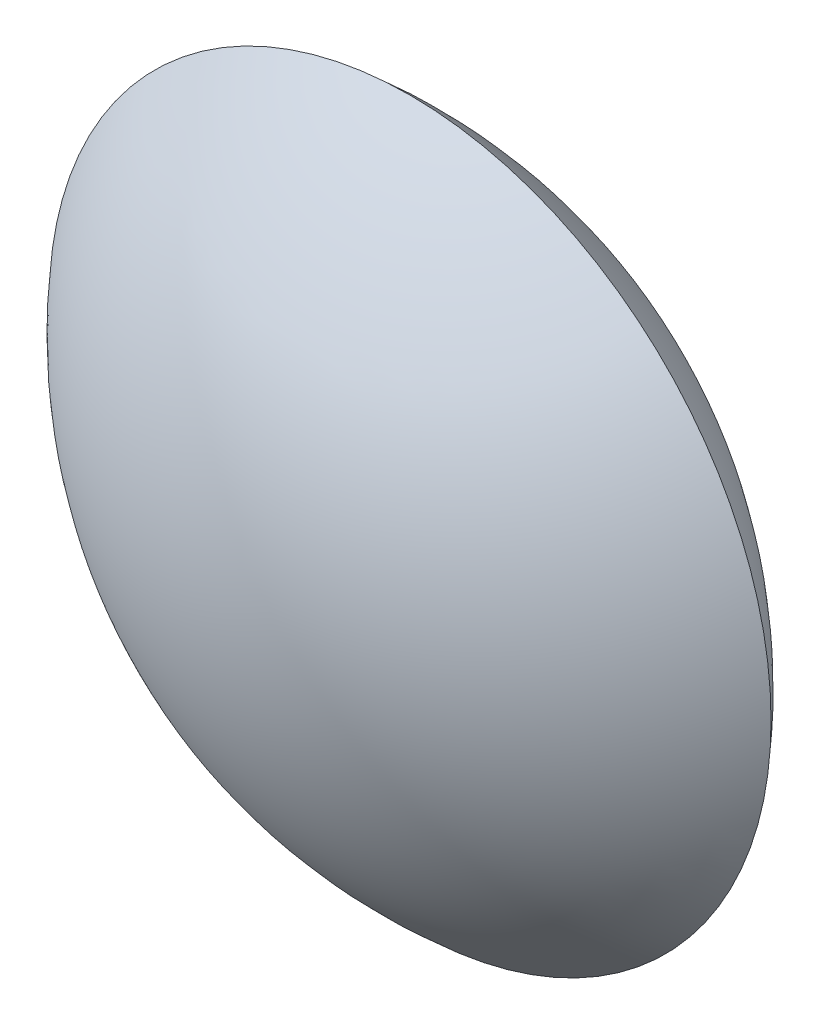
from build123d import *


with BuildPart() as part:
    # Sketch1 → Revolve3 (revolve)
    with BuildSketch(Plane(origin=(0, 0, 0), x_dir=(1, 0, 0), z_dir=(0, 1, 0))):
        with BuildLine():
            Line((0, -70.314153269), (0, 70.314153269))
            ThreePointArc((0, 70.314153269), (-83.919366284, 51.888152342), (-152.4, 0))
            ThreePointArc((-152.4, 0), (-83.919366284, -51.888152342), (0, -70.314153269))
        make_face()
    revolve(axis=Axis((0, 0, -90.803316959), (0, 0, 1)))


solid = part.part
